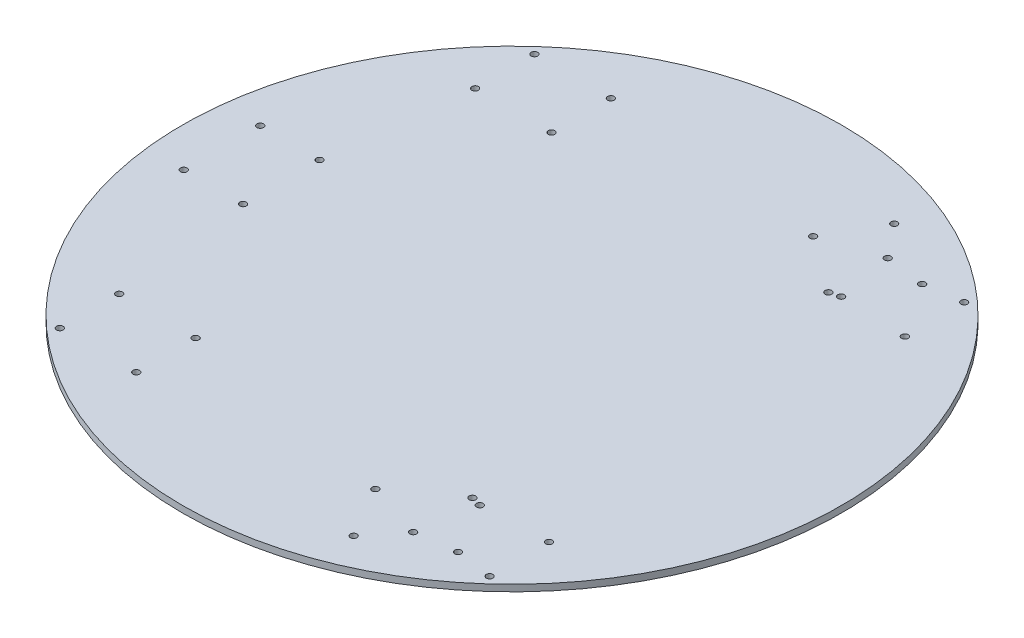
from build123d import *

# Parameters (mm, degrees)
SKETCH_1_R          = 250
EXTRUDE_1_DEPTH     = 5
SKETCH_2_R          = 2.5
CUT_EXTRUDE_1_DEPTH = 354.588744165
SKETCH_3_R          = 2.5
CUT_EXTRUDE_2_DEPTH = 354.588744165


with BuildPart() as part:
    # 草图1 → 凸台-拉伸1 (new body)
    with BuildSketch(Plane(origin=(0, 0, 0), x_dir=(1, 0, 0), z_dir=(0, 1, 0))):
        Circle(SKETCH_1_R)
    extrude(amount=EXTRUDE_1_DEPTH)

    # 草图2 → 切除-拉伸1 (cut, through all)
    with BuildSketch(Plane(origin=(0, 5, 0), x_dir=(1, 0, 0), z_dir=(0, 1, 0))):
        with Locations((-220, -29)):
            Circle(SKETCH_2_R)
        with Locations((-220, 29)):
            Circle(SKETCH_2_R)
        with Locations((-175, -29)):
            Circle(SKETCH_2_R)
        with Locations((-175, 29)):
            Circle(SKETCH_2_R)
        with Locations((84.88526329, 205.025588833)):
            Circle(SKETCH_2_R)
        with Locations((135.11473671, 176.025588833)):
            Circle(SKETCH_2_R)
        with Locations((62.38526329, 166.054445662)):
            Circle(SKETCH_2_R)
        with Locations((112.61473671, 137.054445662)):
            Circle(SKETCH_2_R)
        with Locations((135.11473671, -176.025588833)):
            Circle(SKETCH_2_R)
        with Locations((84.88526329, -205.025588833)):
            Circle(SKETCH_2_R)
        with Locations((112.61473671, -137.054445662)):
            Circle(SKETCH_2_R)
        with Locations((62.38526329, -166.054445662)):
            Circle(SKETCH_2_R)
    extrude(amount=-CUT_EXTRUDE_1_DEPTH, mode=Mode.SUBTRACT)

    # 草图3 → 切除-拉伸2 (cut, through all)
    with BuildSketch(Plane(origin=(0, 5, 0), x_dir=(1, 0, 0), z_dir=(0, 1, 0))):
        with Locations((163, 135)):
            Circle(SKETCH_3_R)
        with Locations((105, 135)):
            Circle(SKETCH_3_R)
        with Locations((105, 180)):
            Circle(SKETCH_3_R)
        with Locations((163, 180)):
            Circle(SKETCH_3_R)
        with Locations((-163, 180)):
            Circle(SKETCH_3_R)
        with Locations((-105, 180)):
            Circle(SKETCH_3_R)
        with Locations((-105, 135)):
            Circle(SKETCH_3_R)
        with Locations((-163, 135)):
            Circle(SKETCH_3_R)
        with Locations((-163, -135)):
            Circle(SKETCH_3_R)
        with Locations((-105, -135)):
            Circle(SKETCH_3_R)
        with Locations((-105, -180)):
            Circle(SKETCH_3_R)
        with Locations((-163, -180)):
            Circle(SKETCH_3_R)
        with Locations((163, -180)):
            Circle(SKETCH_3_R)
        with Locations((105, -180)):
            Circle(SKETCH_3_R)
        with Locations((105, -135)):
            Circle(SKETCH_3_R)
        with Locations((163, -135)):
            Circle(SKETCH_3_R)
    extrude(amount=-CUT_EXTRUDE_2_DEPTH, mode=Mode.SUBTRACT)


solid = part.part
